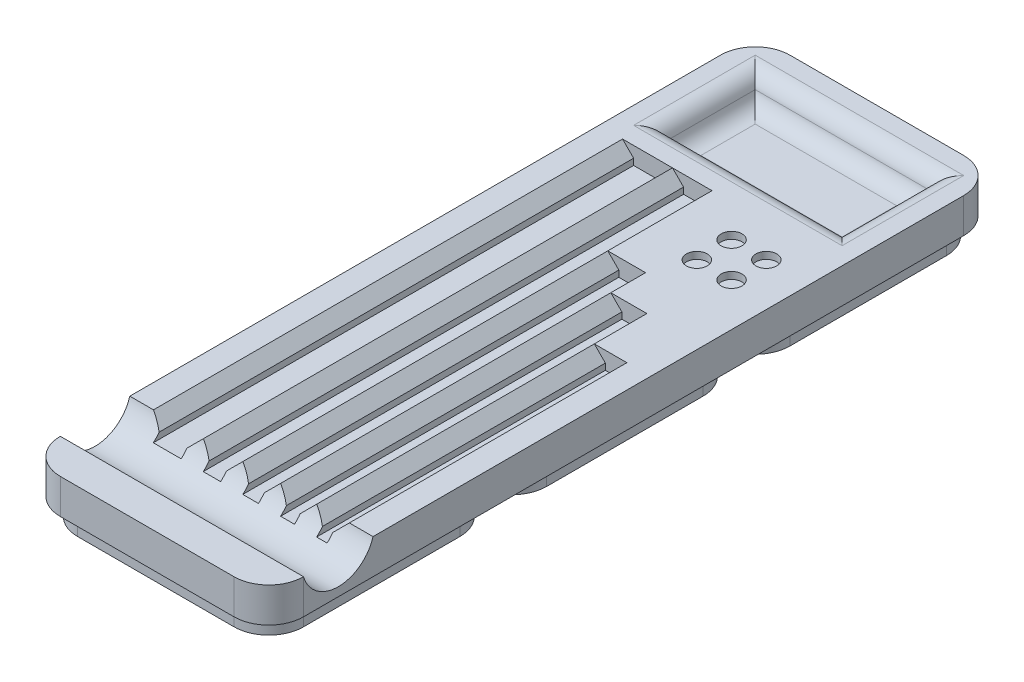
from build123d import *

# Parameters (mm, degrees)
BOSS_EXTRUDE4_DEPTH = 5
SKETCH7_R           = 3
CUT_EXTRUDE4_DEPTH  = 2
SKETCH8_W           = 70
SKETCH8_H           = 70
BOSS_EXTRUDE5_DEPTH = 10
MIRROR2_OUTLINE_R   = 3
MIRROR2_DEPTH       = 15
MIRROR2_START       = 5
MIRROR2_2_OUTLINE_W = 70
MIRROR2_2_OUTLINE_H = 70
MIRROR2_2_OUTLINE_R = 3
MIRROR2_2_DEPTH     = 10
MIRROR2_START_2     = 2
MIRROR2_3_OUTLINE_R = 3
MIRROR2_3_DEPTH     = 3
FILLET1_R           = 10
SKETCH9_W           = 8
SKETCH9_H           = 150
SKETCH9_W_2         = 5
SKETCH9_W_3         = 4.5
SKETCH9_H_2         = 120
SKETCH9_W_4         = 4
SKETCH9_H_3         = 110
SKETCH9_W_5         = 3
SKETCH9_H_4         = 95
CUT_EXTRUDE5_DEPTH  = 5
SKETCH13_W          = 8
SKETCH13_H          = 5
SKETCH13_W_2        = 5
SKETCH13_W_3        = 4.5
SKETCH13_W_4        = 4
SKETCH13_W_5        = 3
SKETCH13_H_2        = 4.875858763
CUT_EXTRUDE8_DEPTH  = 5
SKETCH14_W          = 50
SKETCH14_H          = 5
BOSS_EXTRUDE6_DEPTH = 5
CUT_EXTRUDE9_DEPTH  = 128.082650271
CHAMFER1_SIZE       = 3.1875
SKETCH18_W          = 50
SKETCH18_H          = 25
CUT_EXTRUDE11_DEPTH = 7.5
FILLET3_R           = 5
FILLET4_R           = 5
CUT_EXTRUDE12_DEPTH = 2


# Read off the part's stored shape, not the designer's step: Mirror2
with BuildPart() as part:
    # Sketch5 → Boss-Extrude4 (new body)
    with BuildSketch(Plane(origin=(0, 0, 0), x_dir=(1, 0, 0), z_dir=(0, 1, 0))):
        with BuildLine():
            Line((-22.5, -32.5), (22.5, -32.5))
            ThreePointArc((22.5, -32.5), (29.571067812, -29.571067812), (32.5, -22.5))
            Line((32.5, -22.5), (32.5, 22.5))
            ThreePointArc((32.5, 22.5), (29.571067812, 29.571067812), (22.5, 32.5))
            Line((22.5, 32.5), (-22.5, 32.5))
            ThreePointArc((-22.5, 32.5), (-29.571067812, 29.571067812), (-32.5, 22.5))
            Line((-32.5, 22.5), (-32.5, -22.5))
            ThreePointArc((-32.5, -22.5), (-29.571067812, -29.571067812), (-22.5, -32.5))
        make_face()
    extrude(amount=BOSS_EXTRUDE4_DEPTH)

    # Sketch7 → Cut-Extrude4 (cut)
    with BuildSketch(Plane.XZ):
        with Locations(Location((-26.035533906, 26.035533906, 0), (0, 0, 270))):
            Circle(SKETCH7_R)
        with Locations(Location((26.036533906, 26.036533906, 0), (0, 0, 270))):
            Circle(SKETCH7_R)
        with Locations(Location((26.037533906, -26.035533906, 0), (0, 0, 270))):
            Circle(SKETCH7_R)
        with Locations(Location((-26.034533906, -26.036533906, 0), (0, 0, 270))):
            Circle(SKETCH7_R)
    extrude(amount=-CUT_EXTRUDE4_DEPTH, mode=Mode.SUBTRACT)

    # Sketch8 → Boss-Extrude5 (add)
    with BuildSketch(Plane(origin=(0, 5, 0), x_dir=(1, 0, 0), z_dir=(0, 1, 0))):
        Rectangle(SKETCH8_W, SKETCH8_H)
    extrude(amount=BOSS_EXTRUDE5_DEPTH)



with BuildPart() as body_2:
    # Mirror2 outline → Mirror2 (new body)
    # profile 1 of 2: a face of its own
    with BuildSketch(Plane(origin=(0, 0, 0), x_dir=(1, 0, 0), z_dir=(0, 1, 0))):
        with BuildLine():
            Line((32.5, -92.5), (32.5, -47.5))
            ThreePointArc((32.5, -47.5), (29.571067812, -40.428932188), (22.5, -37.5))
            Line((22.5, -37.5), (-22.5, -37.5))
            ThreePointArc((-22.5, -37.5), (-29.571067812, -40.428932188), (-32.5, -47.5))
            Line((-32.5, -47.5), (-32.5, -92.5))
            ThreePointArc((-32.5, -92.5), (-29.571067812, -99.571067812), (-22.5, -102.5))
            Line((-22.5, -102.5), (22.5, -102.5))
            ThreePointArc((22.5, -102.5), (29.571067812, -99.571067812), (32.5, -92.5))
        make_face()
        with Locations((-26.034533906, -96.036533906)):
            Circle(MIRROR2_OUTLINE_R, mode=Mode.SUBTRACT)
        with Locations((-26.035533906, -43.964466094)):
            Circle(MIRROR2_OUTLINE_R, mode=Mode.SUBTRACT)
        with Locations((26.037533906, -96.035533906)):
            Circle(MIRROR2_OUTLINE_R, mode=Mode.SUBTRACT)
        with Locations((26.036533906, -43.963466094)):
            Circle(MIRROR2_OUTLINE_R, mode=Mode.SUBTRACT)
    # profile 2 of 2: a face of its own
    with BuildSketch(Plane(origin=(0, 0, 0), x_dir=(1, 0, 0), z_dir=(0, 1, 0))):
        with BuildLine():
            Line((32.5, 47.5), (32.5, 92.5))
            ThreePointArc((32.5, 92.5), (29.571067812, 99.571067812), (22.5, 102.5))
            Line((22.5, 102.5), (-22.5, 102.5))
            ThreePointArc((-22.5, 102.5), (-29.571067812, 99.571067812), (-32.5, 92.5))
            Line((-32.5, 92.5), (-32.5, 47.5))
            ThreePointArc((-32.5, 47.5), (-29.571067812, 40.428932188), (-22.5, 37.5))
            Line((-22.5, 37.5), (22.5, 37.5))
            ThreePointArc((22.5, 37.5), (29.571067812, 40.428932188), (32.5, 47.5))
        make_face()
        with Locations((-26.034533906, 43.963466094)):
            Circle(MIRROR2_OUTLINE_R, mode=Mode.SUBTRACT)
        with Locations((-26.035533906, 96.035533906)):
            Circle(MIRROR2_OUTLINE_R, mode=Mode.SUBTRACT)
        with Locations((26.037533906, 43.964466094)):
            Circle(MIRROR2_OUTLINE_R, mode=Mode.SUBTRACT)
        with Locations((26.036533906, 96.036533906)):
            Circle(MIRROR2_OUTLINE_R, mode=Mode.SUBTRACT)
    extrude(amount=MIRROR2_DEPTH)


with BuildPart() as part_1:
    add(part.part)

    add(body_2.part)  # Mirror2 2 merges body 2
    # Mirror2 2 outline → Mirror2 2 (add)
    # profile 1 of 10: a face of its own
    with BuildSketch(Plane(origin=(0, 0, 0), x_dir=(1, 0, 0), z_dir=(0, 1, 0)).offset(MIRROR2_START)):
        with Locations((0, -70)):
            Rectangle(MIRROR2_2_OUTLINE_W, MIRROR2_2_OUTLINE_H)
        with BuildLine():
            ThreePointArc((22.5, -37.5), (29.571067812, -40.428932188), (32.5, -47.5))
            Line((32.5, -47.5), (32.5, -92.5))
            ThreePointArc((32.5, -92.5), (29.571067812, -99.571067812), (22.5, -102.5))
            Line((22.5, -102.5), (-22.5, -102.5))
            ThreePointArc((-22.5, -102.5), (-29.571067812, -99.571067812), (-32.5, -92.5))
            Line((-32.5, -92.5), (-32.5, -47.5))
            ThreePointArc((-32.5, -47.5), (-29.571067812, -40.428932188), (-22.5, -37.5))
            Line((-22.5, -37.5), (22.5, -37.5))
        make_face(mode=Mode.SUBTRACT)
    # profile 2 of 10: a face of its own
    with BuildSketch(Plane(origin=(0, 0, 0), x_dir=(1, 0, 0), z_dir=(0, 1, 0)).offset(MIRROR2_START)):
        with Locations((0, 70)):
            Rectangle(MIRROR2_2_OUTLINE_W, MIRROR2_2_OUTLINE_H)
        with BuildLine():
            ThreePointArc((22.5, 102.5), (29.571067812, 99.571067812), (32.5, 92.5))
            Line((32.5, 92.5), (32.5, 47.5))
            ThreePointArc((32.5, 47.5), (29.571067812, 40.428932188), (22.5, 37.5))
            Line((22.5, 37.5), (-22.5, 37.5))
            ThreePointArc((-22.5, 37.5), (-29.571067812, 40.428932188), (-32.5, 47.5))
            Line((-32.5, 47.5), (-32.5, 92.5))
            ThreePointArc((-32.5, 92.5), (-29.571067812, 99.571067812), (-22.5, 102.5))
            Line((-22.5, 102.5), (22.5, 102.5))
        make_face(mode=Mode.SUBTRACT)
    # profile 3 of 10: a face of its own
    with BuildSketch(Plane(origin=(0, 0, 0), x_dir=(1, 0, 0), z_dir=(0, 1, 0)).offset(MIRROR2_START)):
        with Locations((-26.035533906, -43.964466094)):
            Circle(MIRROR2_2_OUTLINE_R)
    # profile 4 of 10: a face of its own
    with BuildSketch(Plane(origin=(0, 0, 0), x_dir=(1, 0, 0), z_dir=(0, 1, 0)).offset(MIRROR2_START)):
        with Locations((26.036533906, -43.963466094)):
            Circle(MIRROR2_2_OUTLINE_R)
    # profile 5 of 10: a face of its own
    with BuildSketch(Plane(origin=(0, 0, 0), x_dir=(1, 0, 0), z_dir=(0, 1, 0)).offset(MIRROR2_START)):
        with Locations((26.037533906, -96.035533906)):
            Circle(MIRROR2_2_OUTLINE_R)
    # profile 6 of 10: a face of its own
    with BuildSketch(Plane(origin=(0, 0, 0), x_dir=(1, 0, 0), z_dir=(0, 1, 0)).offset(MIRROR2_START)):
        with Locations((-26.034533906, -96.036533906)):
            Circle(MIRROR2_2_OUTLINE_R)
    # profile 7 of 10: a face of its own
    with BuildSketch(Plane(origin=(0, 0, 0), x_dir=(1, 0, 0), z_dir=(0, 1, 0)).offset(MIRROR2_START)):
        with Locations((-26.035533906, 96.035533906)):
            Circle(MIRROR2_2_OUTLINE_R)
    # profile 8 of 10: a face of its own
    with BuildSketch(Plane(origin=(0, 0, 0), x_dir=(1, 0, 0), z_dir=(0, 1, 0)).offset(MIRROR2_START)):
        with Locations((26.036533906, 96.036533906)):
            Circle(MIRROR2_2_OUTLINE_R)
    # profile 9 of 10: a face of its own
    with BuildSketch(Plane(origin=(0, 0, 0), x_dir=(1, 0, 0), z_dir=(0, 1, 0)).offset(MIRROR2_START)):
        with Locations((26.037533906, 43.964466094)):
            Circle(MIRROR2_2_OUTLINE_R)
    # profile 10 of 10: a face of its own
    with BuildSketch(Plane(origin=(0, 0, 0), x_dir=(1, 0, 0), z_dir=(0, 1, 0)).offset(MIRROR2_START)):
        with Locations((-26.034533906, 43.963466094)):
            Circle(MIRROR2_2_OUTLINE_R)
    extrude(amount=MIRROR2_2_DEPTH)

    # Mirror2 3 outline → Mirror2 3 (add)
    with BuildSketch(Plane(origin=(0, 0, 0), x_dir=(1, 0, 0), z_dir=(0, 1, 0)).offset(MIRROR2_START_2)):
        with Locations((-26.035533906, -43.964466094)):
            Circle(MIRROR2_3_OUTLINE_R)
        with Locations((26.036533906, -43.963466094)):
            Circle(MIRROR2_3_OUTLINE_R)
        with Locations((26.037533906, -96.035533906)):
            Circle(MIRROR2_3_OUTLINE_R)
        with Locations((-26.034533906, -96.036533906)):
            Circle(MIRROR2_3_OUTLINE_R)
        with Locations((-26.035533906, 96.035533906)):
            Circle(MIRROR2_3_OUTLINE_R)
        with Locations((26.036533906, 96.036533906)):
            Circle(MIRROR2_3_OUTLINE_R)
        with Locations((26.037533906, 43.964466094)):
            Circle(MIRROR2_3_OUTLINE_R)
        with Locations((-26.034533906, 43.963466094)):
            Circle(MIRROR2_3_OUTLINE_R)
    extrude(amount=MIRROR2_3_DEPTH)

    # Fillet1
    fillet1_edges = [part_1.edges().sort_by_distance(p)[0] for p in [
        (35, 10, 105),
        (-35, 10, 105),
        (-35, 10, -105),
        (35, 10, -105),
    ]]
    fillet(fillet1_edges, radius=FILLET1_R)

    # Sketch9 → Cut-Extrude5 (cut)
    with BuildSketch(Plane(origin=(0, 15, 0), x_dir=(1, 0, 0), z_dir=(0, 1, 0))):
        with Locations((-21, -20)):
            Rectangle(SKETCH9_W, SKETCH9_H)
        with Locations((-8.125, -20)):
            Rectangle(SKETCH9_W_2, SKETCH9_H)
        with Locations((3, -35)):
            Rectangle(SKETCH9_W_3, SKETCH9_H_2)
        with Locations((13.625, -40)):
            Rectangle(SKETCH9_W_4, SKETCH9_H_3)
        with Locations((23.5, -47.5)):
            Rectangle(SKETCH9_W_5, SKETCH9_H_4)
    extrude(amount=-CUT_EXTRUDE5_DEPTH, mode=Mode.SUBTRACT)

    # Sketch13 → Cut-Extrude8 (cut)
    with BuildSketch(Plane(origin=(0, 15, 0), x_dir=(1, 0, 0), z_dir=(0, 1, 0))):
        with Locations((-21, 57.5)):
            Rectangle(SKETCH13_W, SKETCH13_H)
        with Locations((-8.125, 57.5)):
            Rectangle(SKETCH13_W_2, SKETCH13_H)
        with Locations((3, 27.5)):
            Rectangle(SKETCH13_W_3, SKETCH13_H)
        with Locations((13.625, 17.5)):
            Rectangle(SKETCH13_W_4, SKETCH13_H)
        with Locations((23.5, 2.437929382)):
            Rectangle(SKETCH13_W_5, SKETCH13_H_2)
    extrude(amount=-CUT_EXTRUDE8_DEPTH, mode=Mode.SUBTRACT)

    # Sketch14 → Boss-Extrude6 (add)
    with BuildSketch(Plane(origin=(0, 15, 0), x_dir=(1, 0, 0), z_dir=(0, 1, 0))):
        with Locations((0, -92.5)):
            Rectangle(SKETCH14_W, SKETCH14_H)
    extrude(amount=-BOSS_EXTRUDE6_DEPTH)

    # Sketch12 → Cut-Extrude9 (cut, through all)
    with BuildSketch(Plane.ZY.offset(35)):
        with BuildLine():
            Line((95, 15), (85, 15))
            Line((85, 15), (75, 15))
            ThreePointArc((75, 15), (85, 7.499999803), (95, 15))
        make_face()
    extrude(amount=-CUT_EXTRUDE9_DEPTH, mode=Mode.SUBTRACT)

    # Chamfer1
    chamfer1_edges = [part_1.edges().sort_by_distance(p)[0] for p in [
        (-17, 15, 7.5),
        (0.75, 15, 22.5),
        (15.625, 15, 27.5),
        (-25, 15, 7.5),
        (-5.625, 15, 7.5),
        (-10.625, 15, 7.5),
        (5.25, 15, 22.5),
        (11.625, 15, 27.5),
        (25, 15, 35.062070618),
        (22, 15, 35.062070618),
    ]]
    chamfer(chamfer1_edges, length=CHAMFER1_SIZE - 0.0001)  # a hair under: the kernel refuses the full size

    # Sketch18 → Cut-Extrude11 (cut)
    with BuildSketch(Plane(origin=(0, 15, 0), x_dir=(1, 0, 0), z_dir=(0, 1, 0))):
        with Locations((0, 82.5)):
            Rectangle(SKETCH18_W, SKETCH18_H)
    extrude(amount=-CUT_EXTRUDE11_DEPTH, mode=Mode.SUBTRACT)

    # Fillet3
    fillet3_edges = [part_1.edges().sort_by_distance(p)[0] for p in [
        (0, 15, -70),
        (25, 15, -82.5),
        (0, 15, -95),
        (-25, 15, -82.5),
    ]]
    fillet(fillet3_edges, radius=FILLET3_R)

    # Fillet4
    fillet4_edges = [part_1.edges().sort_by_distance(p)[0] for p in [
        (-25, 7.5, -82.5),
        (0, 7.5, -95),
        (25, 7.5, -82.5),
        (0, 7.5, -70),
    ]]
    fillet(fillet4_edges, radius=FILLET4_R)

    # Sketch19 → Cut-Extrude12 (cut)
    with BuildSketch(Plane(origin=(0, 15, 0), x_dir=(1, 0, 0), z_dir=(0, 1, 0))):
        with BuildLine():
            ThreePointArc((22.627174595, 43.564371066), (20.505854252, 42.68569141), (19.627174595, 40.564371066))
            Line((19.627174595, 40.564371066), (22.627174595, 40.564371066))
            Line((22.627174595, 40.564371066), (22.627174595, 43.564371066))
        make_face()
        with BuildLine():
            Line((22.627174595, 40.564371066), (19.627174595, 40.564371066))
            ThreePointArc((19.627174595, 40.564371066), (22.627174595, 37.564371066), (25.627174595, 40.564371066))
            ThreePointArc((25.627174595, 40.564371066), (24.748494939, 42.68569141), (22.627174595, 43.564371066))
            Line((22.627174595, 43.564371066), (22.627174595, 40.564371066))
        make_face()
        with BuildLine():
            ThreePointArc((19.627174595, 50.564371066), (20.505854252, 48.443050723), (22.627174595, 47.564371066))
            Line((22.627174595, 47.564371066), (22.627174595, 50.564371066))
            Line((22.627174595, 50.564371066), (19.627174595, 50.564371066))
        make_face()
        with BuildLine():
            Line((22.627174595, 50.564371066), (22.627174595, 47.564371066))
            ThreePointArc((22.627174595, 47.564371066), (24.748494939, 48.443050723), (25.627174595, 50.564371066))
            ThreePointArc((25.627174595, 50.564371066), (22.627174595, 53.564371066), (19.627174595, 50.564371066))
            Line((19.627174595, 50.564371066), (22.627174595, 50.564371066))
        make_face()
        with BuildLine():
            ThreePointArc((15.627174595, 50.564371066), (10.505854252, 52.68569141), (12.627174595, 47.564371066))
            Line((12.627174595, 47.564371066), (12.627174595, 50.564371066))
            Line((12.627174595, 50.564371066), (15.627174595, 50.564371066))
        make_face()
        with BuildLine():
            Line((12.627174595, 50.564371066), (12.627174595, 47.564371066))
            ThreePointArc((12.627174595, 47.564371066), (14.748494939, 48.443050723), (15.627174595, 50.564371066))
            Line((15.627174595, 50.564371066), (12.627174595, 50.564371066))
        make_face()
        with BuildLine():
            Line((12.627174595, 43.564371066), (12.627174595, 40.564371066))
            Line((12.627174595, 40.564371066), (15.627174595, 40.564371066))
            ThreePointArc((15.627174595, 40.564371066), (14.748494939, 42.68569141), (12.627174595, 43.564371066))
        make_face()
        with BuildLine():
            Line((15.627174595, 40.564371066), (12.627174595, 40.564371066))
            Line((12.627174595, 40.564371066), (12.627174595, 43.564371066))
            ThreePointArc((12.627174595, 43.564371066), (10.505854252, 38.443050723), (15.627174595, 40.564371066))
        make_face()
    extrude(amount=-CUT_EXTRUDE12_DEPTH, mode=Mode.SUBTRACT)


solid = part_1.part
